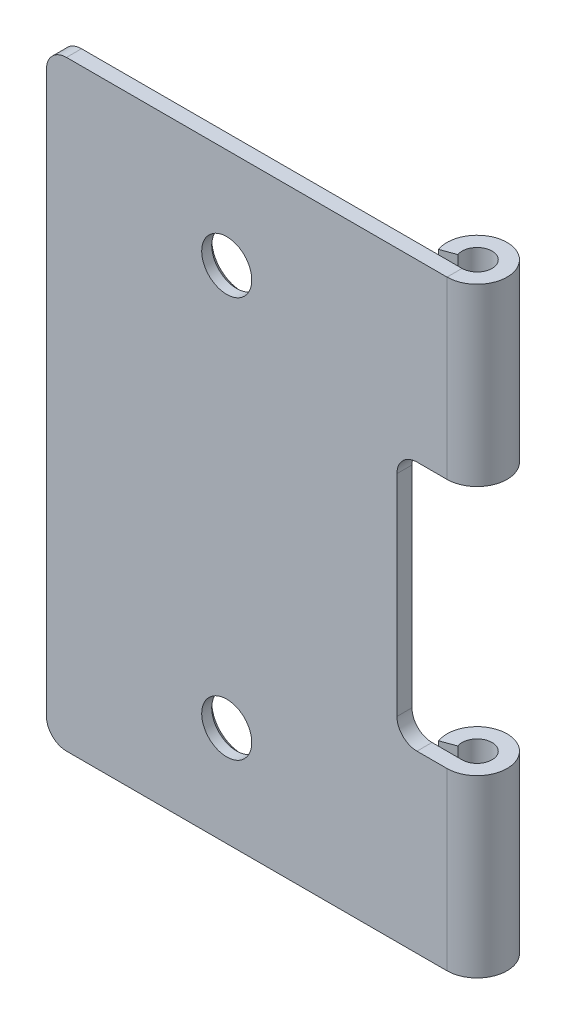
from build123d import *

# Parameters (mm, degrees)
BASE_FLANGE1_DEPTH                             = 3
CUT_EXTRUDE1_DEPTH                             = 11.75046698
CUT_EXTRUDE1_DEPTH_BACK                        = 11.75046698
SKETCH10_W                                     = 0.8
SKETCH10_H                                     = 2.5
FILLET1_R                                      = 0.2
CSK_FOR_M3_FLAT_HEAD_MACHINE_SCREW1_AT_2_COUNT = 2
CSK_FOR_M3_FLAT_HEAD_MACHINE_SCREW1_AT_2_PITCH = 4


# Sheet-metal steps are written as plain solids
with BuildPart() as part:
    # Sketch5 → Base-Flange1 (new, symmetric)
    with BuildSketch(Plane(origin=(0, 0, 0), x_dir=(1, 0, 0), z_dir=(0, 1, 0))):
        with BuildLine():
            ThreePointArc((9.872631336, 0.098696979), (10.099621695, 0.272872807), (10.013585229, 0))
            Line((10.013585229, 0), (6.013585229, 0))
            Line((6.013585229, 0), (6.013585229, -0.15))
            Line((6.013585229, -0.15), (10.013585229, -0.15))
            ThreePointArc((10.013585229, -0.15), (10.18565816, 0.395745613), (9.731677443, 0.047393957))
            Line((9.731677443, 0.047393957), (9.872631336, 0.098696979))
        make_face()
    extrude(amount=BASE_FLANGE1_DEPTH, both=True)

    # Sketch10 → Cut-Extrude1 (cut, two sides: drawn at the far end of the back side and taken through both)
    with BuildSketch(Plane(origin=(0, 0, 0), x_dir=(-1, 0, 0), z_dir=(0, 0, -1)).offset(-CUT_EXTRUDE1_DEPTH_BACK)):
        with Locations((-9.913585229, 0)):
            Rectangle(SKETCH10_W, SKETCH10_H)
    extrude(amount=CUT_EXTRUDE1_DEPTH + CUT_EXTRUDE1_DEPTH_BACK, mode=Mode.SUBTRACT)

    # Fillet1
    fillet1_edges = [part.edges().sort_by_distance(p)[0] for p in [
        (6.013585229, 3, 0.075),
        (9.513585229, -1.25, 0.075),
        (9.513585229, 1.25, 0.075),
        (6.013585229, -3, 0.075),
    ]]
    fillet(fillet1_edges, radius=FILLET1_R)

    # Sketch13 → CSK for M3 Flat Head Machine Screw1 (revolve, cut)
    with BuildSketch(Plane(origin=(7.813585229, 2, 0), x_dir=(0, 1, 0), z_dir=(1, 0, 0))):
        Polygon((0, 0), (0, 0.15), (0.25, 0.15), (0.25, 0.05), (0.3, 0), align=None)
    csk_for_m3_flat_head_machine_screw1 = revolve(axis=Axis((7.813585229, 2, -6.35), (0, 0, 1)), mode=Mode.SUBTRACT)

    # CSK for M3 Flat Head Machine Screw1 at 2: CSK for M3 Flat Head Machine Screw1 ×2
    with Locations(*[(0, -i * CSK_FOR_M3_FLAT_HEAD_MACHINE_SCREW1_AT_2_PITCH, 0) for i in range(1, CSK_FOR_M3_FLAT_HEAD_MACHINE_SCREW1_AT_2_COUNT)]):
        add(csk_for_m3_flat_head_machine_screw1, mode=Mode.SUBTRACT)


solid = part.part
